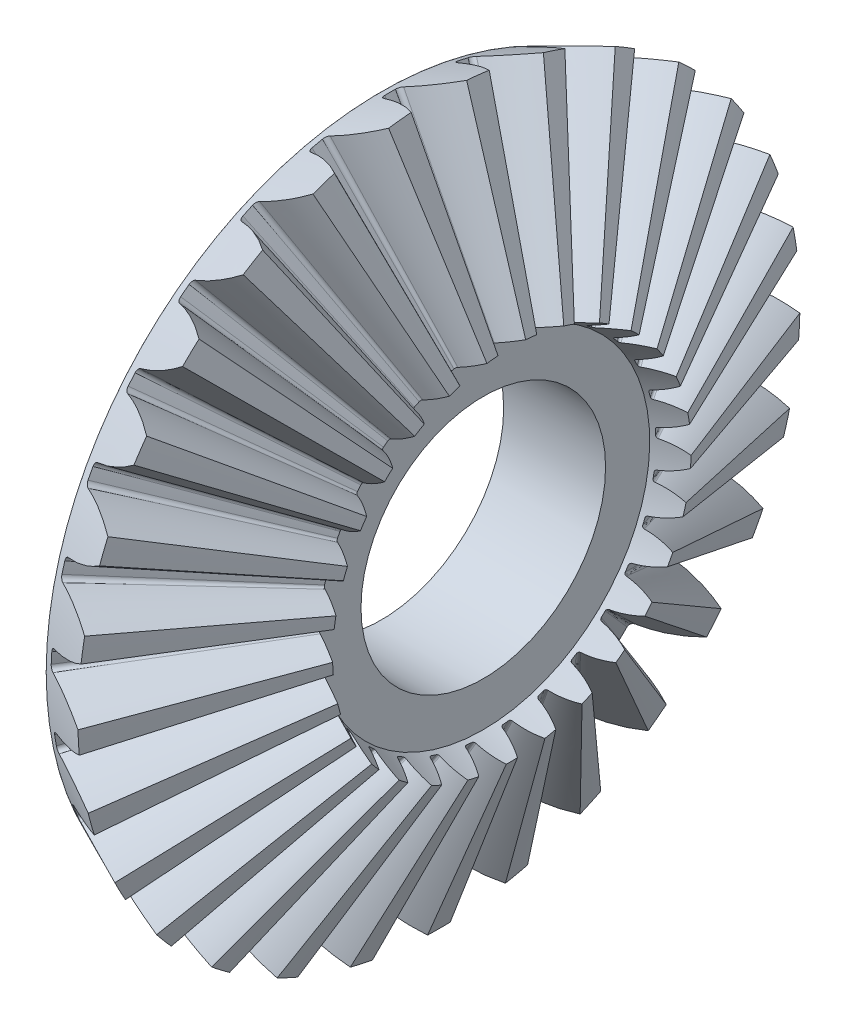
from build123d import *

# Parameters (mm, degrees)
TEETHCUTS_COUNT = 29
TEETHCUTS_ANGLE = 347.586206897
HUBSKE_R        = 13.704098687
HUB_DEPTH       = 0.0001016
BORSKE_R        = 5
BORE_DEPTH      = 8.27552296


with BuildPart() as part:
    # BasProSke → Base-Revolve (revolve)
    with BuildSketch(Plane(origin=(0, 0, 0), x_dir=(1, 0, 0), z_dir=(0, 1, 0)), mode=Mode.PRIVATE) as base_revolve_sk:
        Polygon((0, 0), (0, 13.704098689), (2.352577345, 14.758702323), (5.334478989, 7.328383153), (4.166314756, 6.804723326), (4.166314756, 0), align=None)
    revolve(base_revolve_sk.sketch.rotate(Axis((-10, 0, 0), (1, 0, 0)), 180), axis=Axis((-10, 0, 0), (1, 0, 0)))

    # ToothCut: read off the stored shape, not the designer's step
    # ToothCut: loft between two sections, ruled curve by curve
    toothcut_from = [
        Edge.make_bspline([(8.284381621, 0.003993896, -0.00812157), (8.278687641, 0.001441422, -0.015623166), (8.26981798, -0.002534633, -0.014768433), (8.265406021, -0.004512408, -0.006292969)], [0, 0, 0, 0, 1, 1, 1, 1], 3, [1, 0.713127629, 0.713127629, 1]),
        Edge.make_bspline([(8.265406021, -0.004512408, 0.006292969), (8.26981798, -0.002534633, 0.014768433), (8.278687641, 0.001441422, 0.015623166), (8.284381621, 0.003993896, 0.00812157)], [0, 0, 0, 0, 1, 1, 1, 1], 3, [1, 0.713127629, 0.713127629, 1]),
        Edge.make_bspline([(8.265406021, -0.004512408, -0.006292969), (8.264879758, -0.004748318, -0.005282008), (8.264484452, -0.004925525, -0.00420174), (8.264227515, -0.005040703, -0.003072419)], [0, 0, 0, 0, 1, 1, 1, 1], 3, [1, 0.993750069, 0.993750069, 1]),
        Edge.make_bspline([(8.264227515, -0.005040703, 0.003072419), (8.264484452, -0.004925525, 0.00420174), (8.264879758, -0.004748318, 0.005282008), (8.265406021, -0.004512408, 0.006292969)], [0, 0, 0, 0, 1, 1, 1, 1], 3, [1, 0.993750069, 0.993750069, 1]),
        Edge.make_bspline([(8.264227515, -0.005040703, -0.003072419), (8.263766208, -0.005247496, -0.001044831), (8.263766208, -0.005247496, 0.001044831), (8.264227515, -0.005040703, 0.003072419)], [0, 0, 0, 0, 1, 1, 1, 1], 3, [1, 0.980197003, 0.980197003, 1]),
        Edge.make_line((8.284381621, 0.003993896, 0.00812157), (8.284381621, 0.003993896, -0.00812157)),
    ]
    toothcut_to = [
        Edge.make_bspline([(2.578505041, 14.859980256, -1.302558296), (1.948720038, 14.577662841, -0.843491701), (1.244683545, 14.262060277, -0.540503172), (0.498141963, 13.927403707, -0.407255062)], [0, 0, 0, 0, 1, 1, 1, 1], 3, [1, 0.984969339, 0.984969339, 1]),
        Edge.make_bspline([(0.498141963, 13.927403707, 0.407255062), (1.244683545, 14.262060277, 0.540503172), (1.948720038, 14.577662841, 0.843491701), (2.578505041, 14.859980256, 1.302558296)], [0, 0, 0, 0, 1, 1, 1, 1], 3, [1, 0.984969339, 0.984969339, 1]),
        Edge.make_bspline([(0.498141963, 13.927403707, -0.407255062), (0.409510531, 13.887672375, -0.391435487), (0.351916982, 13.861854578, -0.315931892), (0.353426213, 13.862531129, -0.217536603)], [0, 0, 0, 0, 1, 1, 1, 1], 3, [1, 0.837569211, 0.837569211, 1]),
        Edge.make_bspline([(0.353426213, 13.862531129, 0.217536603), (0.351916982, 13.861854578, 0.315931892), (0.409510531, 13.887672375, 0.391435487), (0.498141963, 13.927403707, 0.407255062)], [0, 0, 0, 0, 1, 1, 1, 1], 3, [1, 0.837569211, 0.837569211, 1]),
        Edge.make_bspline([(0.353426213, 13.862531129, -0.217536603), (0.355650557, 13.863528249, -0.072519029), (0.355650557, 13.863528249, 0.072519029), (0.353426213, 13.862531129, 0.217536603)], [0, 0, 0, 0, 1, 1, 1, 1], 3, [1, 0.999905838, 0.999905838, 1]),
        Edge.make_line((2.578505041, 14.859980256, 1.302558296), (2.578505041, 14.859980256, -1.302558296)),
    ]
    toothcut = Solid(Shell([*[Face.make_surface_from_curves(toothcut_from[k], toothcut_to[k]) for k in range(6)], Face(Wire(toothcut_from)), Face(Wire(toothcut_to))]))
    add(toothcut, mode=Mode.SUBTRACT)

    # TeethCuts: ToothCut ×29 about axis
    teethcuts_axis = Axis((-10, 0, 0), (1, 0, 0))
    for i in range(1, TEETHCUTS_COUNT):
        add(toothcut.rotate(teethcuts_axis, i * TEETHCUTS_ANGLE / (TEETHCUTS_COUNT - 1)), mode=Mode.SUBTRACT)

    # HubSke → Hub (add)
    with BuildSketch(Plane.ZY):
        Circle(HUBSKE_R)
    extrude(amount=HUB_DEPTH)

    # BorSke → Bore (cut, symmetric)
    with BuildSketch(Plane(origin=(0, 0, 0), x_dir=(0, 0, -1), z_dir=(1, 0, 0))):
        with Locations(Location((0, 0, 0), (0, 0, 180))):
            Circle(BORSKE_R)
    extrude(amount=BORE_DEPTH, both=True, mode=Mode.SUBTRACT)


solid = part.part
